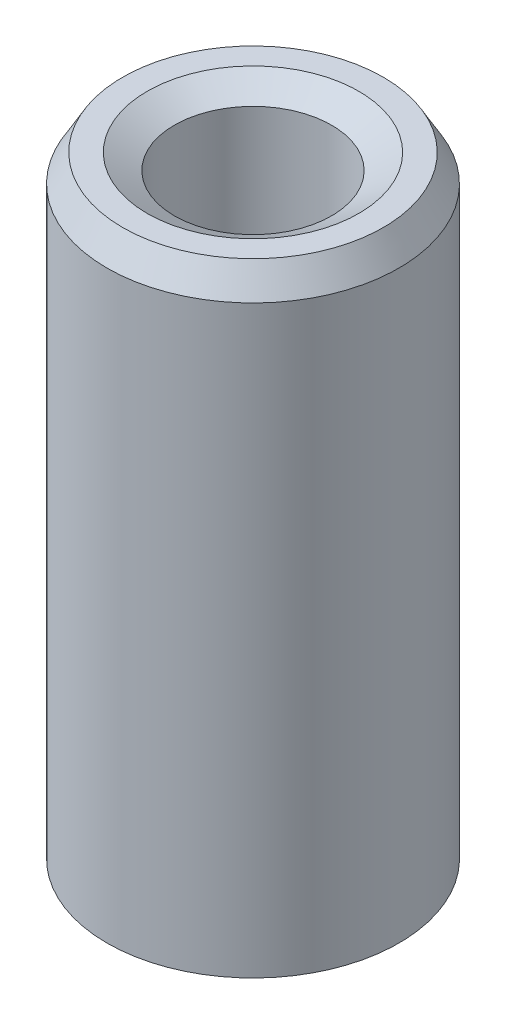
from build123d import *
from OCP.BRepFilletAPI import BRepFilletAPI_MakeChamfer

# Parameters (mm, degrees)
SKETCH1_R           = 5
BOSS_EXTRUDE1_DEPTH = 21.489854793
SKETCH2_R           = 2.692253067
CUT_EXTRUDE1_DEPTH  = 23.623303451
CHAMFER1_SIZE       = 0.93219599
CHAMFER1_SIZE2      = 0.538203606


with BuildPart() as part:
    # Sketch1 → Boss-Extrude1 (new body)
    with BuildSketch(Plane(origin=(0, 0, 0), x_dir=(1, 0, 0), z_dir=(0, 1, 0))):
        Circle(SKETCH1_R)
    extrude(amount=BOSS_EXTRUDE1_DEPTH)

    # Sketch2 → Cut-Extrude1 (cut, through all)
    with BuildSketch(Plane(origin=(0, 0, 0), x_dir=(1, 0, 0), z_dir=(0, 1, 0))):
        Circle(SKETCH2_R)
    extrude(amount=CUT_EXTRUDE1_DEPTH, mode=Mode.SUBTRACT)

    # Chamfer1: one chamfer whose edges measure the first distance from different faces: ONE call of the kernel's chamfer builder (chamfer() names one face for all edges)
    chamfer1_edges_1 = [part.edges().sort_by_distance(p)[0] for p in [
        (-2.692253067, 21.489854793, 0),
    ]]
    chamfer1_side_1 = [part.faces().sort_by_distance(p)[0] for p in [
        (-4.858578644, 21.489854793, 0),
    ]]
    chamfer1_edges_2 = [part.edges().sort_by_distance(p)[0] for p in [
        (-2.692253067, 0, 0),
    ]]
    chamfer1_side_2 = [part.faces().sort_by_distance(p)[0] for p in [
        (-2.692253067, 10.744927396, 0),
    ]]
    chamfer1_edges_3 = [part.edges().sort_by_distance(p)[0] for p in [
        (-5, 0, 0),
    ]]
    chamfer1_side_3 = [part.faces().sort_by_distance(p)[0] for p in [
        (-4.858578644, 0, 0),
    ]]
    chamfer1_edges_4 = [part.edges().sort_by_distance(p)[0] for p in [
        (-5, 21.489854793, 0),
    ]]
    chamfer1_side_4 = [part.faces().sort_by_distance(p)[0] for p in [
        (-5, 10.744927396, 0),
    ]]
    chamfer1 = BRepFilletAPI_MakeChamfer(part.part.solid().wrapped)
    for e in chamfer1_edges_1:
        chamfer1.Add(CHAMFER1_SIZE, CHAMFER1_SIZE2, e.wrapped, chamfer1_side_1[0].wrapped)  # the first distance lies on this face
    for e in chamfer1_edges_2:
        chamfer1.Add(CHAMFER1_SIZE, CHAMFER1_SIZE2, e.wrapped, chamfer1_side_2[0].wrapped)  # the first distance lies on this face
    for e in chamfer1_edges_3:
        chamfer1.Add(CHAMFER1_SIZE, CHAMFER1_SIZE2, e.wrapped, chamfer1_side_3[0].wrapped)  # the first distance lies on this face
    for e in chamfer1_edges_4:
        chamfer1.Add(CHAMFER1_SIZE, CHAMFER1_SIZE2, e.wrapped, chamfer1_side_4[0].wrapped)  # the first distance lies on this face
    add(Compound.cast(chamfer1.Shape()), mode=Mode.REPLACE)


solid = part.part
